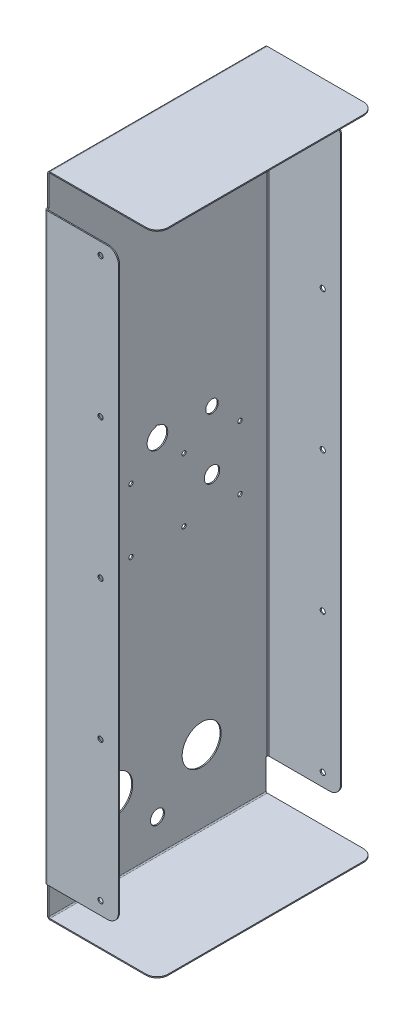
from build123d import *

# Parameters (mm, degrees)
BASE_FLANGE1_DEPTH           = 147.5
EDGE_FLANGE1_DEPTH           = 792
EDGE_FLANGE1_BEND_DEPTH      = 792
F_7_0_7_DIAMETER_HOLE1_D     = 7
F_7_0_7_DIAMETER_HOLE1_DEPTH = 1.5
FILLET1_R                    = 15
SKETCH14_R                   = 26.5
CUT_EXTRUDE1_DEPTH           = 488.566918484
M16_CLEARANCE_HOLE1_D        = 19
M5_CLEARANCE_HOLE1_D         = 5.8
M20_CLEARANCE_HOLE1_D        = 21
CUT_EXTRUDE2_DEPTH           = 488.566918484
CUT_EXTRUDE3_DEPTH           = 488.566918484


# Sheet-metal steps are written as plain solids
with BuildPart() as part:
    # Sketch1 → Base-Flange1 (new, symmetric)
    with BuildSketch(Plane.XY):
        with BuildLine():
            Line((147, 438), (1.5, 438))
            ThreePointArc((1.5, 438), (0.439339828, 437.560660172), (0, 436.5))
            Line((0, 436.5), (0, -436.5))
            ThreePointArc((0, -436.5), (0.439339828, -437.560660172), (1.5, -438))
            Line((1.5, -438), (147, -438))
            Line((147, -438), (147, -439.5))
            Line((147, -439.5), (1.5, -439.5))
            ThreePointArc((1.5, -439.5), (-0.621320344, -438.621320344), (-1.5, -436.5))
            Line((-1.5, -436.5), (-1.5, 436.5))
            ThreePointArc((-1.5, 436.5), (-0.621320344, 438.621320344), (1.5, 439.5))
            Line((1.5, 439.5), (147, 439.5))
            Line((147, 439.5), (147, 438))
        make_face()
    extrude(amount=BASE_FLANGE1_DEPTH, both=True)

    # Edge-Flange1 section (across the edge) → Edge-Flange1 (add)
    with BuildSketch(Plane(origin=(0, 396, 150), x_dir=(0, 0, -1), z_dir=(0, -1, 0))):
        with BuildLine():
            Line((-1.5, 1.5), (-1.5, 98.5))
            Line((-1.5, 98.5), (0, 98.5))
            Line((0, 98.5), (0, 1.5))
            ThreePointArc((0, 1.5), (0.439339828, 0.439339828), (1.5, 0))
            Line((1.5, 0), (2.5, 0))
            Line((2.5, 0), (2.5, -1.5))
            Line((2.5, -1.5), (1.5, -1.5))
            ThreePointArc((1.5, -1.5), (-0.621320344, -0.621320344), (-1.5, 1.5))
        make_face()
    extrude(amount=EDGE_FLANGE1_DEPTH)

    # Edge-Flange1 section 2 (across the edge) → Edge-Flange1 bend (add)
    with BuildSketch(Plane(origin=(0, -396, -150), x_dir=(0, 0, 1), z_dir=(0, 1, 0))):
        with BuildLine():
            Line((-1.5, 1.5), (-1.5, 98.5))
            Line((-1.5, 98.5), (0, 98.5))
            Line((0, 98.5), (0, 1.5))
            ThreePointArc((0, 1.5), (0.439339828, 0.439339828), (1.5, 0))
            Line((1.5, 0), (2.5, 0))
            Line((2.5, 0), (2.5, -1.5))
            Line((2.5, -1.5), (1.5, -1.5))
            ThreePointArc((1.5, -1.5), (-0.621320344, -0.621320344), (-1.5, 1.5))
        make_face()
    extrude(amount=EDGE_FLANGE1_BEND_DEPTH)

    # Ø7.0 (7) Diameter Hole1
    with Locations(Plane(origin=(0, 0, 150), x_dir=(-1, 0, 0), z_dir=(0, 0, -1))):
        with Locations((-74.25, 379.5), (-74.25, 190), (-74.25, 0.5), (-74.25, -189), (-74.25, -378.5)):
            f_7_0_7_diameter_hole1 = Hole(F_7_0_7_DIAMETER_HOLE1_D / 2, depth=F_7_0_7_DIAMETER_HOLE1_DEPTH)

    # Mirror1: Ø7.0 (7) Diameter Hole1 across plane
    add(f_7_0_7_diameter_hole1.mirror(Plane.XY), mode=Mode.SUBTRACT)

    # Fillet1
    fillet1_edges = [part.edges().sort_by_distance(p)[0] for p in [
        (147, 438.75, -147.5),
        (147, -438.75, -147.5),
        (147, 438.75, 147.5),
        (98.5, 396, 150.75),
        (98.5, -396, 150.75),
        (98.5, -396, -150.75),
        (98.5, 396, -150.75),
        (147, -438.75, 147.5),
    ]]
    fillet(fillet1_edges, radius=FILLET1_R)

    # Sketch14 → Cut-Extrude1 (cut, through all)
    with BuildSketch(Plane(origin=(0, 0, 0), x_dir=(0, 0, -1), z_dir=(1, 0, 0))):
        with Locations((-60, -338)):
            Circle(SKETCH14_R)
        with Locations((60, -338)):
            Circle(SKETCH14_R)
    extrude(amount=-CUT_EXTRUDE1_DEPTH, mode=Mode.SUBTRACT)

    # M16 Clearance Hole1 (through all)
    with Locations(Plane(origin=(0, 0, 0), x_dir=(0, 0, -1), z_dir=(1, 0, 0))):
        with Locations((0, -393)):
            Hole(M16_CLEARANCE_HOLE1_D / 2)

    # M5 Clearance Hole1 (through all)
    with Locations(Plane(origin=(0, 0, 0), x_dir=(0, 0, -1), z_dir=(1, 0, 0))):
        with Locations((-112, 16.324175824), (-36, -69.675824176), (-112, -69.675824176), (-36, 16.324175824)):
            m5_clearance_hole1 = Hole(M5_CLEARANCE_HOLE1_D / 2)

    # Mirror2: M5 Clearance Hole1 across plane
    add(m5_clearance_hole1.mirror(Plane.XY), mode=Mode.SUBTRACT)

    # M20 Clearance Hole1 (through all)
    with Locations(Plane(origin=(0, 0, 0), x_dir=(0, 0, -1), z_dir=(1, 0, 0))):
        with Locations((-74, -27.5), (74, -27.5)):
            Hole(M20_CLEARANCE_HOLE1_D / 2)

    # Sketch22 → Cut-Extrude2 (cut, through all)
    with BuildSketch(Plane(origin=(0, 0, 0), x_dir=(0, 0, -1), z_dir=(1, 0, 0))):
        with BuildLine():
            Line((-82, 49.627718677), (-82, 55.372281323))
            ThreePointArc((-82, 55.372281323), (-74, 61), (-66, 55.372281323))
            Line((-66, 55.372281323), (-66, 49.627718677))
            ThreePointArc((-66, 49.627718677), (-74, 44), (-82, 49.627718677))
        make_face()
    cut_extrude2 = extrude(amount=-CUT_EXTRUDE2_DEPTH, mode=Mode.SUBTRACT)

    # Mirror3: Cut-Extrude2 across plane
    add(cut_extrude2.mirror(Plane.XY), mode=Mode.SUBTRACT)

    # Sketch23 → Cut-Extrude3 (cut, through all)
    with BuildSketch(Plane(origin=(0, 0, 0), x_dir=(0, 0, -1), z_dir=(1, 0, 0))):
        with BuildLine():
            Line((-1.65, 67.5), (-1.65, 66.402427846))
            ThreePointArc((-1.65, 66.402427846), (0, 38.5), (1.65, 66.402427846))
            Line((1.65, 66.402427846), (1.65, 67.5))
            Line((1.65, 67.5), (-1.65, 67.5))
        make_face()
    extrude(amount=-CUT_EXTRUDE3_DEPTH, mode=Mode.SUBTRACT)


solid = part.part
